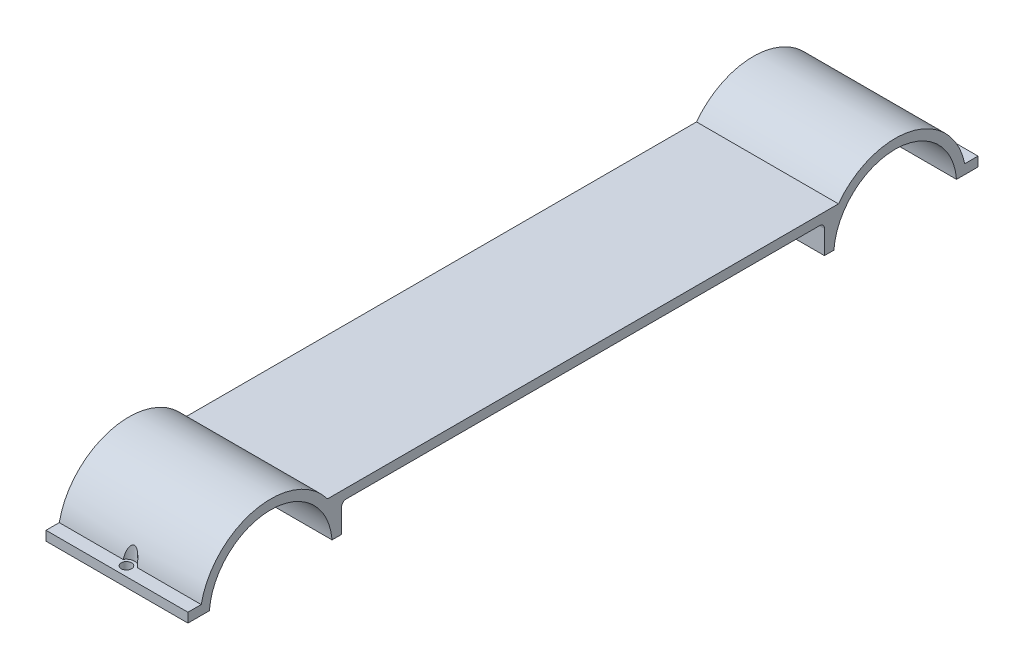
from build123d import *

# Parameters (mm, degrees)
EXTRUDE_1_DEPTH      = 15
EXTRUDE_1_DEPTH_BACK = 15
FILLET_4_R           = 1
SKETCH_2_R           = 1.1
CUT_EXTRUDE_1_DEPTH  = 10
SKETCH_3_R           = 1.703478165
CUT_EXTRUDE_2_DEPTH  = 10


with BuildPart() as part:
    # Эскиз1 → Бобышка-Вытянуть1 (new, two sides: drawn at the far end of the back side and taken through both)
    with BuildSketch(Plane(origin=(0, 0, 0), x_dir=(0, 0, -1), z_dir=(1, 0, 0)).offset(-EXTRUDE_1_DEPTH_BACK)):
        with BuildLine():
            Line((-83.5, 3), (-83.5, 1))
            Line((-83.5, 1), (-78.961481397, 1))
            ThreePointArc((-78.961481397, 1), (-66, 13), (-53.038518603, 1))
            Line((-53.038518603, 1), (-51.038518603, 1))
            Line((-51.038518603, 1), (-51.038518603, 7))
            Line((-51.038518603, 7), (51.038518603, 7))
            Line((51.038518603, 7), (51.038518603, 1))
            Line((51.038518603, 1), (53.038518603, 1))
            ThreePointArc((53.038518603, 1), (66, 13), (78.961481397, 1))
            Line((78.961481397, 1), (83.5, 1))
            Line((83.5, 1), (83.5, 3))
            Line((83.5, 3), (80.696938457, 3))
            ThreePointArc((80.696938457, 3), (69.289128952, 14.634945533), (54, 9))
            Line((54, 9), (-54, 9))
            ThreePointArc((-54, 9), (-69.289128952, 14.634945533), (-80.696938457, 3))
            Line((-80.696938457, 3), (-83.5, 3))
        make_face()
    extrude(amount=EXTRUDE_1_DEPTH + EXTRUDE_1_DEPTH_BACK)

    # Скругление4
    fillet_4_edges = [part.edges().sort_by_distance(p)[0] for p in [
        (0, 7, -51.038518603),
        (0, 7, 51.038518603),
    ]]
    fillet(fillet_4_edges, radius=FILLET_4_R)

    # Эскиз2 → Вырез-Вытянуть1 (cut, symmetric)
    with BuildSketch(Plane(origin=(0, 3, 0), x_dir=(1, 0, 0), z_dir=(0, 1, 0))):
        with Locations((0, 81.5)):
            Circle(SKETCH_2_R)
    cut_extrude_1 = extrude(amount=CUT_EXTRUDE_1_DEPTH, both=True, mode=Mode.SUBTRACT)

    # Эскиз3 → Вырез-Вытянуть2 (cut)
    with BuildSketch(Plane(origin=(0, 3, 0), x_dir=(1, 0, 0), z_dir=(0, 1, 0))):
        with Locations((0, 81.5)):
            Circle(SKETCH_3_R)
    cut_extrude_2 = extrude(amount=CUT_EXTRUDE_2_DEPTH, mode=Mode.SUBTRACT)

    # Зеркальное отражение1: Вырез-Вытянуть1, Вырез-Вытянуть2 across plane
    add(cut_extrude_1.mirror(Plane.XY), mode=Mode.SUBTRACT)
    add(cut_extrude_2.mirror(Plane.XY), mode=Mode.SUBTRACT)


solid = part.part
